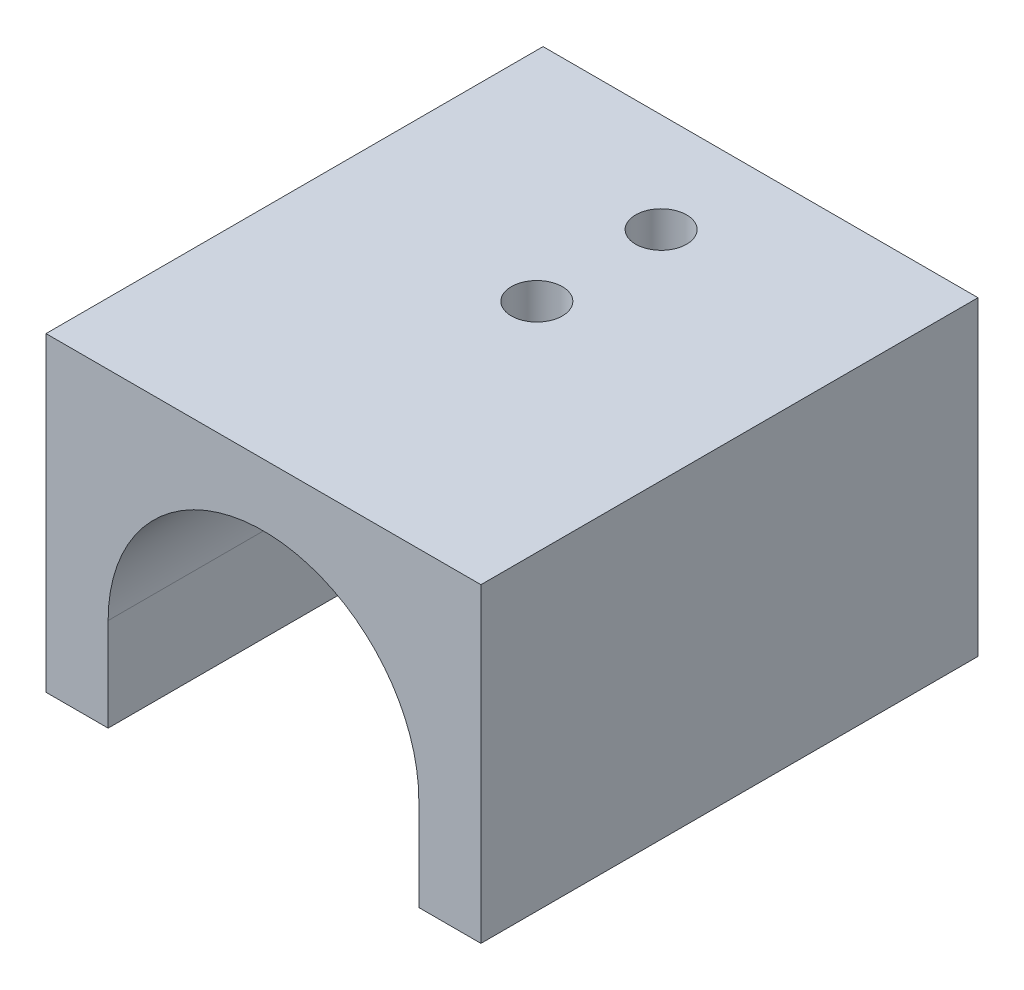
from build123d import *

# Parameters (mm, degrees)
BOSS_EXTRUDE1_DEPTH     = 20
CUT_EXTRUDE1_REACH      = 38.486
CUT_EXTRUDE1_END_RADIUS = 12.5
SKETCH2_R               = 2.05


with BuildPart() as part:
    # Sketch1 → Boss-Extrude1 (new, symmetric)
    with BuildSketch(Plane.XY):
        with BuildLine():
            Line((-17.5, 17.5), (17.5, 17.5))
            Line((17.5, 17.5), (17.5, -7.5))
            Line((17.5, -7.5), (12.5, -7.5))
            Line((12.5, -7.5), (12.5, 0))
            ThreePointArc((12.5, 0), (0, 12.5), (-12.5, 0))
            Line((-12.5, 0), (-12.5, -7.5))
            Line((-12.5, -7.5), (-17.5, -7.5))
            Line((-17.5, -7.5), (-17.5, 17.5))
        make_face()
    extrude(amount=BOSS_EXTRUDE1_DEPTH, both=True)

    # Cut-Extrude1: up to this cylinder (the profile starts outside it)
    cut_extrude1_end = Plane(origin=(0, 0, -7), z_dir=(0, 0, -1)) * Cylinder(CUT_EXTRUDE1_END_RADIUS, 112.972, mode=Mode.PRIVATE)
    # Sketch2 → Cut-Extrude1 (cut, up to the surface)
    with BuildSketch(Plane(origin=(0, 17.5, 0), x_dir=(1, 0, 0), z_dir=(0, 1, 0)), mode=Mode.PRIVATE) as cut_extrude1_sk1:
        with Locations((0, 12)):
            Circle(SKETCH2_R)
    cut_extrude1_tool1 = extrude(cut_extrude1_sk1.sketch, amount=-CUT_EXTRUDE1_REACH, mode=Mode.PRIVATE) - cut_extrude1_end
    add(cut_extrude1_tool1.solids().sort_by_distance((0, 17.5, -12))[0], mode=Mode.SUBTRACT)
    # Sketch2 → Cut-Extrude1 (cut, up to the surface)
    with BuildSketch(Plane(origin=(0, 17.5, 0), x_dir=(1, 0, 0), z_dir=(0, 1, 0)), mode=Mode.PRIVATE) as cut_extrude1_sk2:
        with Locations((0, 2)):
            Circle(SKETCH2_R)
    cut_extrude1_tool2 = extrude(cut_extrude1_sk2.sketch, amount=-CUT_EXTRUDE1_REACH, mode=Mode.PRIVATE) - cut_extrude1_end
    add(cut_extrude1_tool2.solids().sort_by_distance((0, 17.5, -2))[0], mode=Mode.SUBTRACT)


solid = part.part
